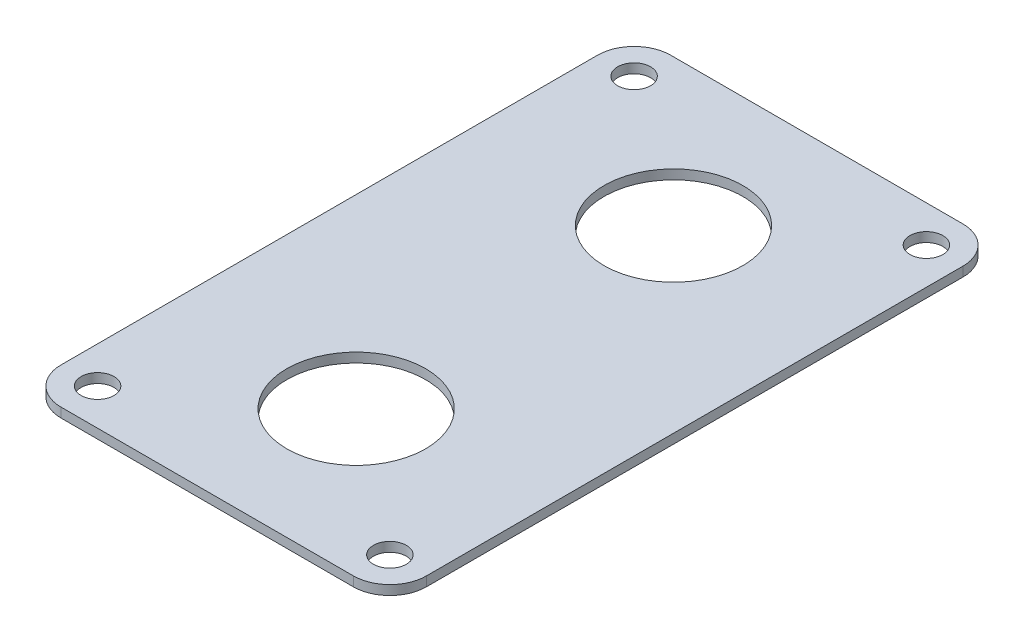
from build123d import *

# Parameters (mm, degrees)
SKETCH1_W          = 50
SKETCH1_H          = 83.414309181
BASE_FLANGE1_DEPTH = 1.3
FILLET1_R          = 5
SKETCH6_R          = 9.5
CUT_EXTRUDE1_DEPTH = 10
SKETCH7_R          = 2.25
CUT_EXTRUDE2_DEPTH = 10


# Sheet-metal steps are written as plain solids
with BuildPart() as part:
    # Sketch1 → Base-Flange1 (new body)
    with BuildSketch(Plane(origin=(0, 0, 0), x_dir=(1, 0, 0), z_dir=(0, 1, 0))):
        with Locations((-0.387063477, 0.292845409)):
            Rectangle(SKETCH1_W, SKETCH1_H)
    extrude(amount=-BASE_FLANGE1_DEPTH)

    # Fillet1
    fillet1_edges = [part.edges().sort_by_distance(p)[0] for p in [
        (24.612936523, -0.65, 41.414309181),
        (-25.387063477, -0.65, 41.414309181),
        (-25.387063477, -0.65, -42),
        (24.612936523, -0.65, -42),
    ]]
    fillet(fillet1_edges, radius=FILLET1_R)

    # Sketch6 → Cut-Extrude1 (cut)
    with BuildSketch(Plane(origin=(0, 0, 0), x_dir=(1, 0, 0), z_dir=(0, 1, 0))):
        with Locations(Location((0, 22, 0), (0, 0, 270))):
            Circle(SKETCH6_R)
        with Locations(Location((0, -21.414309181, 0), (0, 0, 270))):
            Circle(SKETCH6_R)
    extrude(amount=-CUT_EXTRUDE1_DEPTH, mode=Mode.SUBTRACT)

    # Sketch7 → Cut-Extrude2 (cut)
    with BuildSketch(Plane(origin=(0, 0, 0), x_dir=(1, 0, 0), z_dir=(0, 1, 0))):
        with Locations(Location((19.612936523, 37, 0), (0, 0, 270))):
            Circle(SKETCH7_R)
        with Locations(Location((-20.387063477, 37, 0), (0, 0, 270))):
            Circle(SKETCH7_R)
        with Locations(Location((-20.387063477, -36.414309181, 0), (0, 0, 270))):
            Circle(SKETCH7_R)
        with Locations(Location((19.612936523, -36.414309181, 0), (0, 0, 270))):
            Circle(SKETCH7_R)
    extrude(amount=-CUT_EXTRUDE2_DEPTH, mode=Mode.SUBTRACT)


solid = part.part
